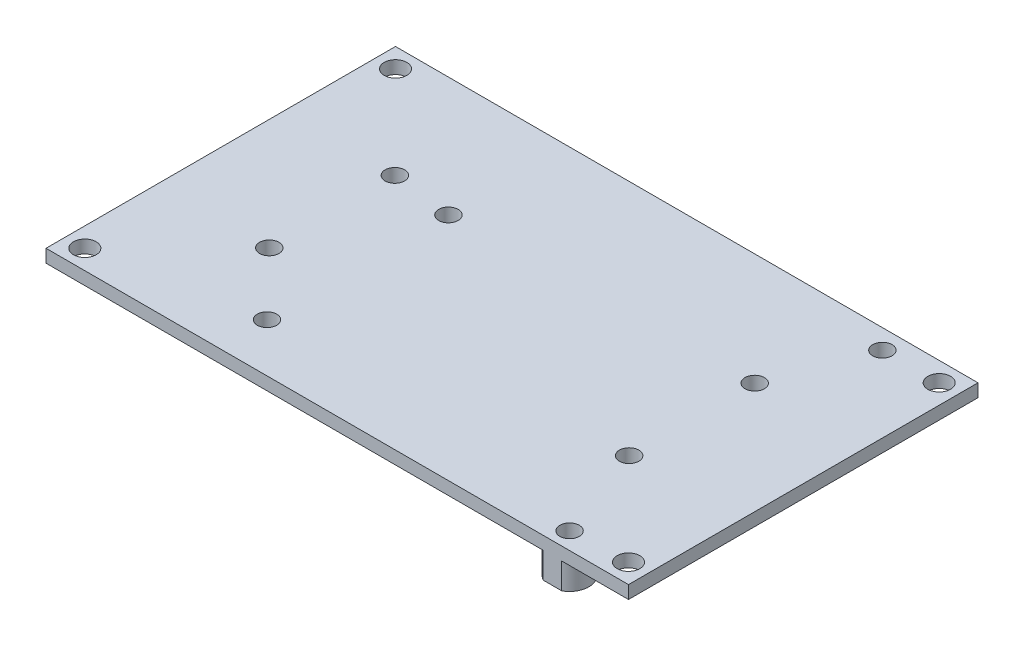
from build123d import *

# Parameters (mm, degrees)
SKETCH2_W           = 45
SKETCH2_H           = 27
SKETCH2_R           = 1.5
SKETCH2_R_2         = 1.75
BOSS_EXTRUDE1_DEPTH = 2
BOSS_EXTRUDE2_START = -5
SKETCH5_R           = 3
SKETCH5_R_2         = 1.5
BOSS_EXTRUDE2_DEPTH = 5
SKETCH8_R           = 3
SKETCH8_R_2         = 1.5
BOSS_EXTRUDE3_DEPTH = 4
CUT_EXTRUDE1_START  = -4
SKETCH8_5_R         = 1.5
CUT_EXTRUDE1_DEPTH  = 4


with BuildPart() as part:
    # Sketch2 → Boss-Extrude1 (new body)
    with BuildSketch(Plane(origin=(0, 1, 0), x_dir=(1, 0, 0), z_dir=(0, 1, 0))):
        with Locations((-22.5, -13.5)):
            Rectangle(SKETCH2_W, SKETCH2_H)
        with Locations((-27.8, -9.7)):
            Circle(SKETCH2_R, mode=Mode.SUBTRACT)
        with Locations((-42, -24)):
            Circle(SKETCH2_R_2, mode=Mode.SUBTRACT)
    extrude(amount=BOSS_EXTRUDE1_DEPTH)

    # Sketch5 → Boss-Extrude2 (add)
    with BuildSketch(Plane(origin=(0, 3, 0), x_dir=(1, 0, 0), z_dir=(0, 1, 0)).offset(BOSS_EXTRUDE2_START)):
        with Locations((-27.8, -9.7)):
            Circle(SKETCH5_R)
        with Locations((-27.8, -9.7)):
            Circle(SKETCH5_R_2, mode=Mode.SUBTRACT)
    extrude(amount=BOSS_EXTRUDE2_DEPTH)

    # Mirror6: part across plane


with BuildPart() as part_1:
    add(part.part)
    add(part.part.mirror(Plane(origin=(0, 3, 0), x_dir=(0, 0, 1), z_dir=(1, 0, 0))))

    # Mirror7: part across plane


with BuildPart() as part_2:
    add(part_1.part)
    add(part_1.part.mirror(Plane(origin=(-45, 3, 0), x_dir=(1, 0, 0), z_dir=(0, 0, -1))))

    # Sketch8 → Boss-Extrude3 (add)
    # profile 1 of 4: a face of its own
    with BuildSketch(Plane.XZ.offset(-1)):
        with Locations((-18.370750336, -8.547223761)):
            Circle(SKETCH8_R)
        with Locations((-18.370750336, -8.547223761)):
            Circle(SKETCH8_R_2, mode=Mode.SUBTRACT)
    # profile 2 of 4: a face of its own
    with BuildSketch(Plane.XZ.offset(-1)):
        with Locations((-18.370750336, 19.484777469)):
            Circle(SKETCH8_R)
        with Locations((-18.370750336, 19.484777469)):
            Circle(SKETCH8_R_2, mode=Mode.SUBTRACT)
    # profile 3 of 4: a face of its own
    with BuildSketch(Plane.XZ.offset(-1)):
        with Locations((33.254749664, -23.972929765)):
            Circle(SKETCH8_R)
        with Locations((33.254749664, -23.972929765)):
            Circle(SKETCH8_R_2, mode=Mode.SUBTRACT)
    # profile 4 of 4: a face of its own
    with BuildSketch(Plane.XZ.offset(-1)):
        with BuildLine():
            Line((31.8237863, 27), (34.685713027, 27))
            ThreePointArc((34.685713027, 27), (33.254749664, 21.363270235), (31.8237863, 27))
        make_face()
        with Locations((33.254749664, 24.363270235)):
            Circle(SKETCH8_R_2, mode=Mode.SUBTRACT)
    extrude(amount=BOSS_EXTRUDE3_DEPTH)

    # Sketch8<5> → Cut-Extrude1 (cut)
    with BuildSketch(Plane.XZ.offset(-1).offset(CUT_EXTRUDE1_START)):
        with Locations((33.254749664, -23.972929765)):
            Circle(SKETCH8_5_R)
        with Locations((33.254749664, 24.363270235)):
            Circle(SKETCH8_5_R)
        with Locations((-18.370750336, -8.547223761)):
            Circle(SKETCH8_5_R)
        with Locations((-18.370750336, 19.484777469)):
            Circle(SKETCH8_5_R)
    extrude(amount=CUT_EXTRUDE1_DEPTH, mode=Mode.SUBTRACT)


solid = part_2.part
